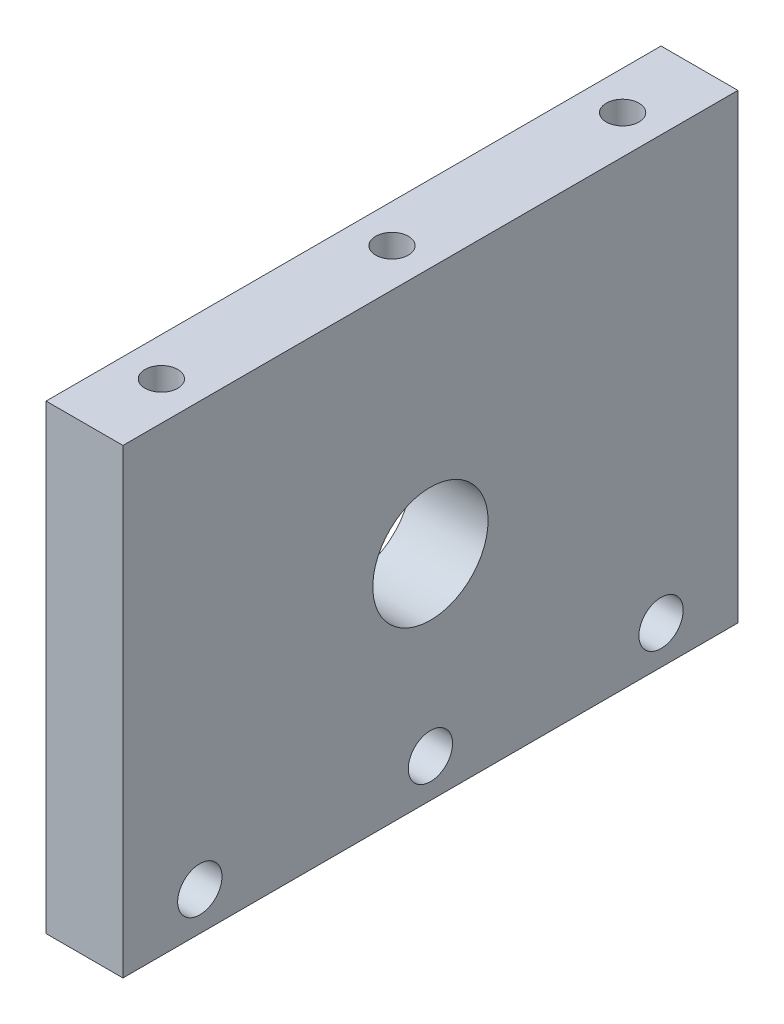
from build123d import *

# Parameters (mm, degrees)
SKETCH1_W                 = 50.8
SKETCH1_H                 = 38.1
BOSS_EXTRUDE1_DEPTH       = 6.35
SKETCH3_R                 = 1.8288
CUT_EXTRUDE1_DEPTH        = 6.35
F_6_32_TAPPED_HOLE1_D     = 2.7051
F_6_32_TAPPED_HOLE1_DEPTH = 11.88730597
F_6_32_TAPPED_HOLE1_TIP   = 0.81269403
SKETCH12_R                = 4.7625
CUT_EXTRUDE3_DEPTH        = 6.35


with BuildPart() as part:
    # Sketch1 → Boss-Extrude1 (new body)
    with BuildSketch(Plane(origin=(0, 0, 0), x_dir=(0, 0, -1), z_dir=(1, 0, 0))):
        with Locations((-25.4, 19.05)):
            Rectangle(SKETCH1_W, SKETCH1_H)
    extrude(amount=BOSS_EXTRUDE1_DEPTH)

    # Sketch3 → Cut-Extrude1 (cut)
    with BuildSketch(Plane(origin=(6.35, 0, 0), x_dir=(0, 0, -1), z_dir=(1, 0, 0))):
        with Locations((-44.45, 3.175)):
            Circle(SKETCH3_R)
        with Locations((-25.4, 3.175)):
            Circle(SKETCH3_R)
        with Locations((-6.35, 3.175)):
            Circle(SKETCH3_R)
    extrude(amount=-CUT_EXTRUDE1_DEPTH, mode=Mode.SUBTRACT)

    # #6-32 Tapped Hole1
    with Locations(Plane(origin=(0, 38.1, 0), x_dir=(1, 0, 0), z_dir=(0, 1, 0))):
        with Locations((3.175, -6.35), (3.175, -25.4), (3.175, -44.45)):
            Hole(F_6_32_TAPPED_HOLE1_D / 2, depth=F_6_32_TAPPED_HOLE1_DEPTH)
            with Locations((0, 0, -(F_6_32_TAPPED_HOLE1_DEPTH + F_6_32_TAPPED_HOLE1_TIP / 2))):  # 118° drill point
                Cone(0, F_6_32_TAPPED_HOLE1_D / 2, F_6_32_TAPPED_HOLE1_TIP, mode=Mode.SUBTRACT)

    # Sketch12 → Cut-Extrude3 (cut)
    with BuildSketch(Plane(origin=(6.35, 0, 0), x_dir=(0, 0, -1), z_dir=(1, 0, 0))):
        with Locations((-25.4, 17.653)):
            Circle(SKETCH12_R)
    extrude(amount=-CUT_EXTRUDE3_DEPTH, mode=Mode.SUBTRACT)


solid = part.part
